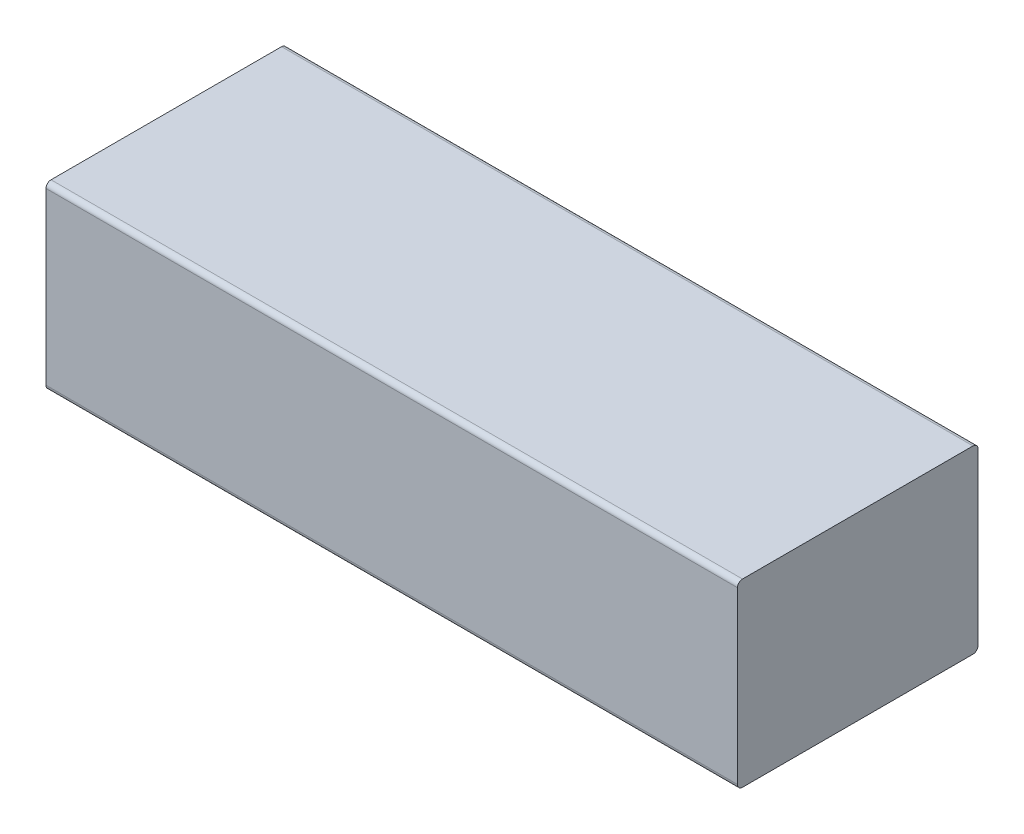
from build123d import *

# Parameters (mm, degrees)
SKETCH1_W           = 138
SKETCH1_H           = 36
BOSS_EXTRUDE1_DEPTH = 48
FILLET2_R           = 1
SKETCH2_W           = 5.121114637
SKETCH2_H           = 9.72723973
CUT_EXTRUDE1_DEPTH  = 4


with BuildPart() as part:
    # Sketch1 → Boss-Extrude1 (new body)
    with BuildSketch(Plane.XY):
        with Locations((69, 18)):
            Rectangle(SKETCH1_W, SKETCH1_H)
    extrude(amount=-BOSS_EXTRUDE1_DEPTH)

    # Fillet2
    fillet2_edges = [part.edges().sort_by_distance(p)[0] for p in [
        (69, 0, -48),
        (69, 0, 0),
        (69, 36, -48),
        (69, 36, 0),
    ]]
    fillet(fillet2_edges, radius=FILLET2_R)

    # Sketch2 → Cut-Extrude1 (cut)
    with BuildSketch(Plane.XZ):
        with Locations((2.560557319, -8.237193023)):
            Rectangle(SKETCH2_W, SKETCH2_H)
    extrude(amount=-CUT_EXTRUDE1_DEPTH, mode=Mode.SUBTRACT)


solid = part.part
